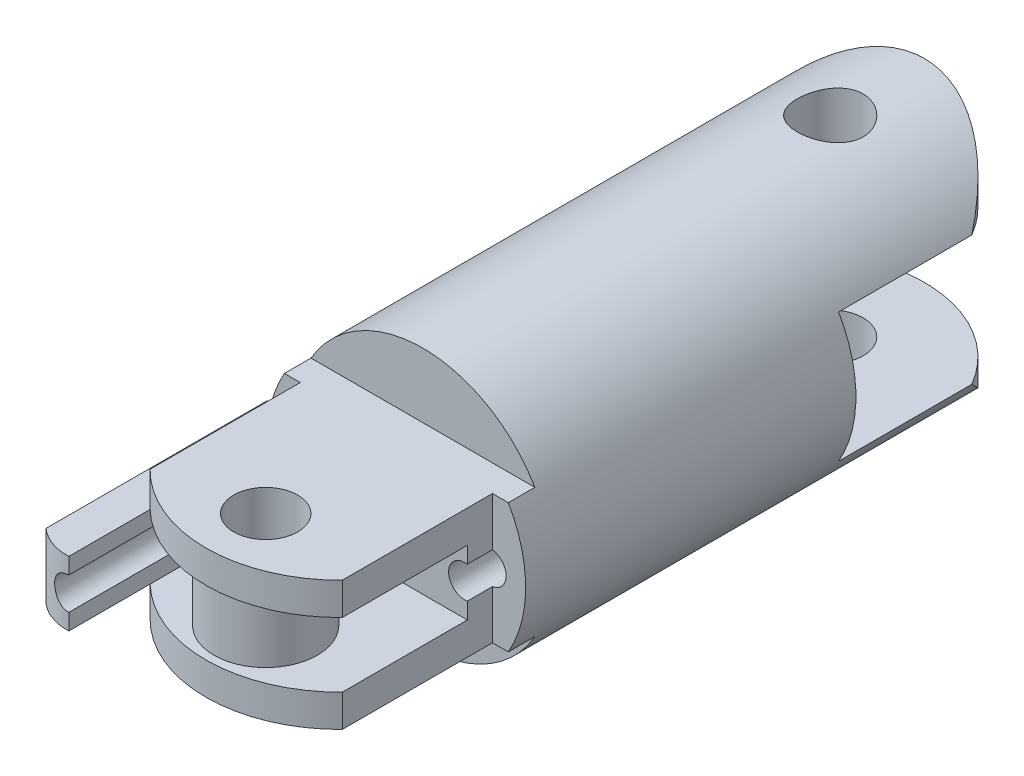
from build123d import *
from build123d.topology import SkipClean

# Parameters (mm, degrees)
SKETCH2_R                       = 10
PHALANGE_LENGTH_DEPTH           = 27.5
BOSS_EXTRUDE3_DEPTH             = 5
BOSS_EXTRUDE4_DEPTH             = 5
BOSS_EXTRUDE4_DEPTH_BACK        = 5
CUT_EXTRUDE2_START              = -15.3025
CUT_EXTRUDE2_DEPTH              = 15.3025
SKETCH7_R                       = 1.65
CUT_EXTRUDE3_DEPTH              = 10
CUT_EXTRUDE4_DEPTH              = 2.5
CUT_EXTRUDE4_DEPTH_BACK         = 2.5
CUT_EXTRUDE7_REACH              = 48.49
SKETCH4_R                       = 1.65
CUT_EXTRUDE7_DIRECTION_2_REACH  = 48.49
CUT_EXTRUDE_THIN1_START         = 27.5
CUT_EXTRUDE_THIN1_DEPTH         = 10.361670454
BOSS_EXTRUDE5_REACH             = 47.744
SKETCH9_R                       = 4
SKETCH9_R_2                     = 1.65
CUT_EXTRUDE8_REACH              = 47.078
SKETCH10_R                      = 1.25
CUT_EXTRUDE9_START              = -4
CUT_EXTRUDE9_DEPTH              = 4
CUT_EXTRUDE10_REACH             = 47.744
CUT_EXTRUDE10_DIRECTION_2_REACH = 47.744
CUT_EXTRUDE11_START             = -10
CUT_EXTRUDE11_OUTLINE_W         = 2.565773848
CUT_EXTRUDE11_OUTLINE_H         = 11.6166929
CUT_EXTRUDE11_DEPTH             = 10
BOSS_EXTRUDE7_REACH             = 45.354
CUT_EXTRUDE12_REACH             = 47.078
SKETCH10_2_R                    = 1.25
CUT_EXTRUDE12_DIRECTION_2_REACH = 47.078
SKETCH17_R                      = 1.25
SKETCH17_W                      = 2.42123439
SKETCH17_H                      = 5
CUT_EXTRUDE14_DEPTH             = 16.148519
SCALE1_SCALE                    = 0.666666667
CUT_EXTRUDE15_START             = -10.000004
SKETCH18_R                      = 1.65
CUT_EXTRUDE15_DEPTH             = 13.333342
CUT_EXTRUDE16_START             = -3.333333
SKETCH19_R                      = 1.7
CUT_EXTRUDE16_DEPTH             = 13.333338


# Read off the part's stored shape, not the designer's step: Cut-Extrude-Thin1, Cut-Extrude11
with BuildPart() as part:
    # Sketch2 → Phalange Length (new body)
    with BuildSketch(Plane.XY):
        Circle(SKETCH2_R)
    extrude(amount=PHALANGE_LENGTH_DEPTH)

    # Sketch3 → Boss-Extrude3 (add)
    with BuildSketch(Plane(origin=(0, -10, 0), x_dir=(-1, 0, 0), z_dir=(0, -1, 0))):
        with BuildLine():
            Line((-10, 5.302499701), (-10, 0))
            Line((-10, 0), (10, 0))
            Line((10, 0), (10, 5.302499701))
            ThreePointArc((10, 5.302499701), (0, 15.302499701), (-10, 5.302499701))
        make_face()
    boss_extrude3 = extrude(amount=-BOSS_EXTRUDE3_DEPTH)

    # Mirror1: Boss-Extrude3 across plane
    add(boss_extrude3.mirror(Plane.ZX))

    # Sketch5 → Boss-Extrude4 (add, two sides: drawn at the far end of the back side and taken through both)
    with BuildSketch(Plane(origin=(0, 0, 0), x_dir=(1, 0, 0), z_dir=(0, 1, 0)).offset(-BOSS_EXTRUDE4_DEPTH_BACK)):
        with BuildLine():
            Line((-10, -33.283157911), (-10, -27.5))
            Line((-10, -27.5), (10, -27.5))
            Line((10, -27.5), (10, -33.283157911))
            ThreePointArc((10, -33.283157911), (0, -42.851984156), (-10, -33.283157911))
        make_face()
    extrude(amount=BOSS_EXTRUDE4_DEPTH + BOSS_EXTRUDE4_DEPTH_BACK)

    # Sketch6 → Cut-Extrude2 (cut)
    with SkipClean():  # the faces are left unmerged after this step: merging them gives an invalid solid
        with BuildSketch(Plane.XY.offset(CUT_EXTRUDE2_START)):
            with BuildLine():
                ThreePointArc((0, 10), (5, 8.660254038), (8.660254038, 5))
                Line((8.660254038, 5), (10, 5))
                Line((10, 5), (10, 10))
                Line((10, 10), (0, 10))
            make_face()
            with BuildLine():
                Line((10, -5), (8.660254038, -5))
                ThreePointArc((8.660254038, -5), (5, -8.660254038), (0, -10))
                Line((0, -10), (10, -10))
                Line((10, -10), (10, -5))
            make_face()
            with BuildLine():
                ThreePointArc((-8.660254038, 5), (-5, 8.660254038), (0, 10))
                Line((0, 10), (-10, 10))
                Line((-10, 10), (-10, 5))
                Line((-10, 5), (-8.660254038, 5))
            make_face()
            with BuildLine():
                Line((-10, -10), (0, -10))
                ThreePointArc((0, -10), (-5, -8.660254038), (-8.660254038, -5))
                Line((-8.660254038, -5), (-10, -5))
                Line((-10, -5), (-10, -10))
            make_face()
        extrude(amount=CUT_EXTRUDE2_DEPTH, mode=Mode.SUBTRACT)

    # Sketch7 → Cut-Extrude3 (cut)
    with SkipClean():  # the faces are left unmerged after this step: merging them gives an invalid solid
        with BuildSketch(Plane(origin=(0, 5, 0), x_dir=(1, 0, 0), z_dir=(0, 1, 0))):
            with Locations(Location((0, -35.661984156, 0), (0, 0, 270))):
                Circle(SKETCH7_R)
        extrude(amount=-CUT_EXTRUDE3_DEPTH, mode=Mode.SUBTRACT)

    # Sketch5<2> → Cut-Extrude4 (cut, two sides: drawn at the far end of the back side and taken through both)
    with BuildSketch(Plane(origin=(0, 0, 0), x_dir=(1, 0, 0), z_dir=(0, 1, 0)).offset(-CUT_EXTRUDE4_DEPTH_BACK)):
        with BuildLine():
            Line((-10, -33.283157911), (-10, -27.5))
            Line((-10, -27.5), (10, -27.5))
            Line((10, -27.5), (10, -33.283157911))
            ThreePointArc((10, -33.283157911), (0, -42.851984156), (-10, -33.283157911))
        make_face()
    extrude(amount=CUT_EXTRUDE4_DEPTH + CUT_EXTRUDE4_DEPTH_BACK, mode=Mode.SUBTRACT)

    # Sketch4 → Cut-Extrude7 (cut, up to next)
    with BuildSketch(Plane(origin=(0, -5, 0), x_dir=(1, 0, 0), z_dir=(0, 1, 0)), mode=Mode.PRIVATE) as cut_extrude7_sk1:
        with Locations(Location((0, 8.010159673, 0), (0, 0, 270))):
            Circle(SKETCH4_R)
    cut_extrude7_tool1 = extrude(cut_extrude7_sk1.sketch, amount=-CUT_EXTRUDE7_REACH, mode=Mode.PRIVATE) & part.part
    add(cut_extrude7_tool1.solids().sort_by_distance((0, -5, -8.01016))[0], mode=Mode.SUBTRACT)

    # Sketch4 → Cut-Extrude7 direction 2 (cut, up to next)
    with BuildSketch(Plane(origin=(0, -5, 0), x_dir=(1, 0, 0), z_dir=(0, 1, 0)), mode=Mode.PRIVATE) as cut_extrude7_direction_2_sk1:
        with Locations(Location((0, 8.010159673, 0), (0, 0, 270))):
            Circle(SKETCH4_R)
    cut_extrude7_direction_2_tool1 = extrude(cut_extrude7_direction_2_sk1.sketch, amount=CUT_EXTRUDE7_DIRECTION_2_REACH, mode=Mode.PRIVATE) & part.part
    add(cut_extrude7_direction_2_tool1.solids().sort_by_distance((0, -5, -8.01016))[0], mode=Mode.SUBTRACT)

    # Cut-Extrude-Thin1 outline → Cut-Extrude-Thin1 (cut)
    with SkipClean():  # the faces are left unmerged after this step: merging them gives an invalid solid
        with BuildSketch(Plane.XY.offset(CUT_EXTRUDE_THIN1_START)):
            with BuildLine():
                ThreePointArc((8.660254038, 5), (9.256147934, 3.78466979), (9.682458366, 2.5))
                Line((9.682458366, 2.5), (10, 2.5))
                Line((10, 2.5), (10, 5))
                Line((10, 5), (8.660254038, 5))
            make_face()
            with BuildLine():
                Line((10, -2.5), (9.682458366, -2.5))
                ThreePointArc((9.682458366, -2.5), (9.256147934, -3.78466979), (8.660254038, -5))
                Line((8.660254038, -5), (10, -5))
                Line((10, -5), (10, -2.5))
            make_face()
            with BuildLine():
                Line((-10, 2.5), (-9.682458366, 2.5))
                ThreePointArc((-9.682458366, 2.5), (-9.256147934, 3.78466979), (-8.660254038, 5))
                Line((-8.660254038, 5), (-10, 5))
                Line((-10, 5), (-10, 2.5))
            make_face()
            with BuildLine():
                ThreePointArc((-8.660254038, -5), (-9.256147934, -3.78466979), (-9.682458366, -2.5))
                Line((-9.682458366, -2.5), (-10, -2.5))
                Line((-10, -2.5), (-10, -5))
                Line((-10, -5), (-8.660254038, -5))
            make_face()
        extrude(amount=CUT_EXTRUDE_THIN1_DEPTH, mode=Mode.SUBTRACT)

    # Sketch9 → Boss-Extrude5 (add, up to next)
    with BuildSketch(Plane.XZ.offset(-2.5), mode=Mode.PRIVATE) as boss_extrude5_sk1:
        with Locations(Location((0, 35.661984156, 0), (0, 0, 90))):
            Circle(SKETCH9_R)
        with Locations(Location((0, 35.661984156, 0), (0, 0, 90))):
            Circle(SKETCH9_R_2, mode=Mode.SUBTRACT)
    boss_extrude5_tool1 = extrude(boss_extrude5_sk1.sketch, amount=BOSS_EXTRUDE5_REACH, mode=Mode.PRIVATE) - part.part
    add(boss_extrude5_tool1.solids().sort_by_distance((0, 2.5, 31.775121))[0])

    # Sketch10 → Cut-Extrude8 (cut, up to next)
    with BuildSketch(Plane.XY.offset(27.5), mode=Mode.PRIVATE) as cut_extrude8_sk1:
        with Locations((7.239961745, 0)):
            Circle(SKETCH10_R)
    cut_extrude8_tool1 = extrude(cut_extrude8_sk1.sketch, amount=-CUT_EXTRUDE8_REACH, mode=Mode.PRIVATE) & part.part
    # Sketch10 → Cut-Extrude8 (cut, up to next)
    with BuildSketch(Plane.XY.offset(27.5), mode=Mode.PRIVATE) as cut_extrude8_sk2:
        with Locations((-7.239961745, 0)):
            Circle(SKETCH10_R)
    cut_extrude8_tool2 = extrude(cut_extrude8_sk2.sketch, amount=-CUT_EXTRUDE8_REACH, mode=Mode.PRIVATE) & part.part
    add(cut_extrude8_tool1.solids().sort_by_distance((7.239962, 0, 27.5))[0], mode=Mode.SUBTRACT)
    add(cut_extrude8_tool2.solids().sort_by_distance((-7.239962, 0, 27.5))[0], mode=Mode.SUBTRACT)

    # Sketch11 → Cut-Extrude9 (cut)
    with SkipClean():  # the faces are left unmerged after this step: merging them gives an invalid solid
        with BuildSketch(Plane.XY.offset(27.5).offset(CUT_EXTRUDE9_START)):
            with BuildLine():
                ThreePointArc((8.660254038, 5), (0, 10), (-8.660254038, 5))
                Line((-8.660254038, 5), (8.660254038, 5))
            make_face()
            with BuildLine():
                Line((8.660254038, -5), (-8.660254038, -5))
                ThreePointArc((-8.660254038, -5), (0, -10), (8.660254038, -5))
            make_face()
        extrude(amount=CUT_EXTRUDE9_DEPTH, mode=Mode.SUBTRACT)

    # Sketch12 → Cut-Extrude10 (cut, up to next)
    with BuildSketch(Plane.XZ.offset(-2.5), mode=Mode.PRIVATE) as cut_extrude10_sk1:
        with BuildLine():
            Line((-10.033719202, 42.851984156), (-10.033719202, 35.664892021))
            Line((-10.033719202, 35.664892021), (-8.660254038, 35.664892021))
            ThreePointArc((-8.660254038, 35.664892021), (0, 40.290740593), (8.660254038, 35.664892021))
            Line((8.660254038, 35.664892021), (10.033719202, 35.664892021))
            Line((10.033719202, 35.664892021), (10.033719202, 42.851984156))
            Line((10.033719202, 42.851984156), (-10.033719202, 42.851984156))
        make_face()
    cut_extrude10_tool1 = extrude(cut_extrude10_sk1.sketch, amount=CUT_EXTRUDE10_REACH, mode=Mode.PRIVATE) & part.part
    add(cut_extrude10_tool1.solids().sort_by_distance((0, 2.5, 40.350279))[0], mode=Mode.SUBTRACT)

    # Sketch12 → Cut-Extrude10 direction 2 (cut, up to next)
    with BuildSketch(Plane.XZ.offset(-2.5), mode=Mode.PRIVATE) as cut_extrude10_direction_2_sk1:
        with BuildLine():
            Line((-10.033719202, 42.851984156), (-10.033719202, 35.664892021))
            Line((-10.033719202, 35.664892021), (-8.660254038, 35.664892021))
            ThreePointArc((-8.660254038, 35.664892021), (0, 40.290740593), (8.660254038, 35.664892021))
            Line((8.660254038, 35.664892021), (10.033719202, 35.664892021))
            Line((10.033719202, 35.664892021), (10.033719202, 42.851984156))
            Line((10.033719202, 42.851984156), (-10.033719202, 42.851984156))
        make_face()
    cut_extrude10_direction_2_tool1 = extrude(cut_extrude10_direction_2_sk1.sketch, amount=-CUT_EXTRUDE10_DIRECTION_2_REACH, mode=Mode.PRIVATE) & part.part
    add(cut_extrude10_direction_2_tool1.solids().sort_by_distance((0, 2.5, 40.350279))[0], mode=Mode.SUBTRACT)

    # Cut-Extrude11 outline → Cut-Extrude11 (cut)
    with BuildSketch(Plane.XZ.offset(5).offset(CUT_EXTRUDE11_START)):
        with Locations((-8.717113076, 31.360571369)):
            Rectangle(CUT_EXTRUDE11_OUTLINE_W, CUT_EXTRUDE11_OUTLINE_H)
        with Locations((8.717113076, 31.360571369)):
            Rectangle(CUT_EXTRUDE11_OUTLINE_W, CUT_EXTRUDE11_OUTLINE_H)
    extrude(amount=CUT_EXTRUDE11_DEPTH, mode=Mode.SUBTRACT)

    # Boss-Extrude7: up to this face of the body (flat: up to its plane)
    boss_extrude7_end = Plane(part.part.faces().sort_by_distance((0, 2.5, 27.696174341))[0])
    # Sketch16 → Boss-Extrude7 (add, up to the picked face)
    with BuildSketch(Plane(origin=(0, -2.5, 0), x_dir=(1, 0, 0), z_dir=(0, 1, 0)), mode=Mode.PRIVATE) as boss_extrude7_sk1:
        with BuildLine():
            Line((-4.818727355, -25.552224919), (-7.434226152, -25.552224919))
            Line((-7.434226152, -25.552224919), (-10, -25.552224919))
            Line((-10, -25.552224919), (-10, -42.658561033))
            ThreePointArc((-10, -42.658561033), (-8.808295471, -43.390817912), (-7.43422564, -43.652145139))
            ThreePointArc((-7.43422564, -43.652145139), (-6.033645007, -43.399721533), (-4.818727355, -42.658561033))
            Line((-4.818727355, -42.658561033), (-4.818727355, -39.109527951))
            ThreePointArc((-4.818727355, -39.109527951), (-6.204248493, -38.242230104), (-7.437080645, -37.168917819))
            Line((-7.437080645, -37.168917819), (-7.434226152, -37.168917819))
            Line((-7.434226152, -37.168917819), (-7.434226152, -27.5))
            Line((-7.434226152, -27.5), (-4.818727355, -27.5))
            Line((-4.818727355, -27.5), (-4.818727355, -25.552224919))
        make_face()
    boss_extrude7_tool1 = split(extrude(boss_extrude7_sk1.sketch, amount=BOSS_EXTRUDE7_REACH, mode=Mode.PRIVATE), bisect_by=boss_extrude7_end, keep=Keep.BOTH, mode=Mode.PRIVATE)
    # Sketch16 → Boss-Extrude7 (add, up to the picked face)
    with BuildSketch(Plane(origin=(0, -2.5, 0), x_dir=(1, 0, 0), z_dir=(0, 1, 0)), mode=Mode.PRIVATE) as boss_extrude7_sk2:
        with BuildLine():
            Line((-4.818727355, -39.109527951), (-4.818727355, -27.5))
            Line((-4.818727355, -27.5), (-7.434226152, -27.5))
            Line((-7.434226152, -27.5), (-7.434226152, -37.168917819))
            Line((-7.434226152, -37.168917819), (-7.437080645, -37.168917819))
            ThreePointArc((-7.437080645, -37.168917819), (-6.204248493, -38.242230104), (-4.818727355, -39.109527951))
        make_face()
    boss_extrude7_tool2 = split(extrude(boss_extrude7_sk2.sketch, amount=BOSS_EXTRUDE7_REACH, mode=Mode.PRIVATE), bisect_by=boss_extrude7_end, keep=Keep.BOTH, mode=Mode.PRIVATE)
    add(boss_extrude7_tool1.solids().sort_by(Axis((-7.989429, -2.5, 35.133344), (0, 1, 0)))[0])
    add(boss_extrude7_tool2.solids().sort_by(Axis((-6.08748, -2.5, 32.8879), (0, 1, 0)))[0])

    # Sketch10<2> → Cut-Extrude12 (cut, up to next)
    with BuildSketch(Plane.XY.offset(27.5), mode=Mode.PRIVATE) as cut_extrude12_sk1:
        with Locations((-7.239961745, 0)):
            Circle(SKETCH10_2_R)
    cut_extrude12_tool1 = extrude(cut_extrude12_sk1.sketch, amount=CUT_EXTRUDE12_REACH, mode=Mode.PRIVATE) & part.part
    add(cut_extrude12_tool1.solids().sort_by_distance((-7.239962, 0, 27.5))[0], mode=Mode.SUBTRACT)

    # Sketch10<2> → Cut-Extrude12 direction 2 (cut, up to next)
    with BuildSketch(Plane.XY.offset(27.5), mode=Mode.PRIVATE) as cut_extrude12_direction_2_sk1:
        with Locations((-7.239961745, 0)):
            Circle(SKETCH10_2_R)
    cut_extrude12_direction_2_tool1 = extrude(cut_extrude12_direction_2_sk1.sketch, amount=-CUT_EXTRUDE12_DIRECTION_2_REACH, mode=Mode.PRIVATE) & part.part
    add(cut_extrude12_direction_2_tool1.solids().sort_by_distance((-7.239962, 0, 27.5))[0], mode=Mode.SUBTRACT)

    # Sketch17 → Cut-Extrude14 (cut)
    with SkipClean():  # the faces are left unmerged after this step: merging them gives an invalid solid
        with BuildSketch(Plane.XY.offset(27.5)):
            with Locations((-7.239961745, 0)):
                Circle(SKETCH17_R)
            with Locations((-6.02934455, 0)):
                Rectangle(SKETCH17_W, SKETCH17_H)
        extrude(amount=CUT_EXTRUDE14_DEPTH, mode=Mode.SUBTRACT)


with BuildPart() as part_1:
    # Scale1: scaled about (-0.164338402, -1.53e-07, 12.17341687)
    add(part.part.scale(SCALE1_SCALE).moved(Location((-0.054779467, -5.1e-08, 4.057805623))))

    # Sketch18 → Cut-Extrude15 (cut)
    with BuildSketch(Plane(origin=(0, 3.333328643, 0), x_dir=(1, 0, 0), z_dir=(0, 1, 0)).offset(CUT_EXTRUDE15_START)):
        with Locations(Location((-0.054788063, -27.832629086, 0), (0, 0, 270))):
            Circle(SKETCH18_R)
    extrude(amount=CUT_EXTRUDE15_DEPTH, mode=Mode.SUBTRACT)

    # Sketch19 → Cut-Extrude16 (cut)
    with BuildSketch(Plane(origin=(0, -3.333338023, 0), x_dir=(1, 0, 0), z_dir=(0, 1, 0)).offset(CUT_EXTRUDE16_START)):
        with Locations(Location((-0.054788063, 1.282133466, 0), (0, 0, 90))):
            Circle(SKETCH19_R)
    extrude(amount=CUT_EXTRUDE16_DEPTH, mode=Mode.SUBTRACT)


solid = part_1.part
